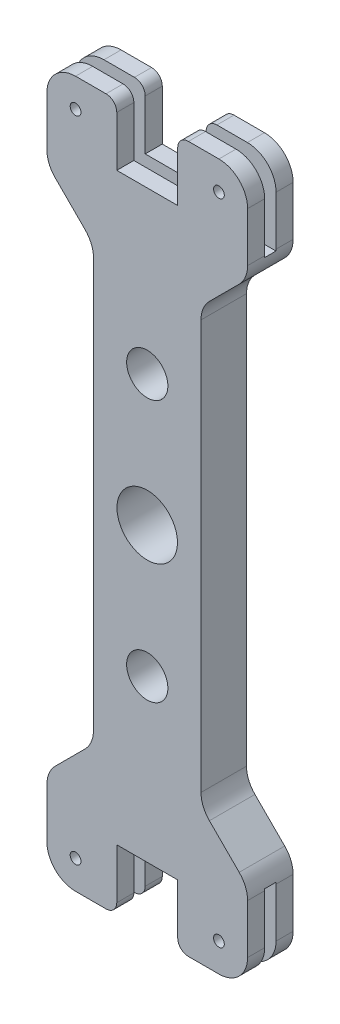
from build123d import *

# Parameters (mm, degrees)
SKETCH1_R                = 8.4375
SKETCH1_R_2              = 1.5
BOSS_EXTRUDE1_DEPTH      = 6.35
FILLET1_R                = 8
SKETCH3_W                = 56
SKETCH3_H                = 3.175
CUT_EXTRUDE1_DEPTH       = 22.22
F_7_16_CLEARANCE_HOLE4_D = 11.50874


with BuildPart() as part:
    # Sketch1 → Boss-Extrude1 (new, symmetric)
    with BuildSketch(Plane.XY):
        with BuildLine():
            Line((-28, 73.397835534), (-28, 90.475))
            ThreePointArc((-28, 90.475), (-25.656854249, 96.131854249), (-20, 98.475))
            Line((-20, 98.475), (-11.5, 98.475))
            ThreePointArc((-11.5, 98.475), (-9.378679656, 97.596320344), (-8.5, 95.475))
            Line((-8.5, 95.475), (-8.5, 81.475))
            Line((-8.5, 81.475), (8.5, 81.475))
            Line((8.5, 81.475), (8.5, 95.475))
            ThreePointArc((8.5, 95.475), (9.378679656, 97.596320344), (11.5, 98.475))
            Line((11.5, 98.475), (20, 98.475))
            ThreePointArc((20, 98.475), (25.656854249, 96.131854249), (28, 90.475))
            Line((28, 90.475), (28, 73.397835534))
            Line((28, 73.397835534), (15, 60.397835534))
            Line((15, 60.397835534), (15, -60.397835534))
            Line((15, -60.397835534), (28, -73.397835534))
            Line((28, -73.397835534), (28, -90.475))
            ThreePointArc((28, -90.475), (25.656854249, -96.131854249), (20, -98.475))
            Line((20, -98.475), (11.5, -98.475))
            ThreePointArc((11.5, -98.475), (9.378679656, -97.596320344), (8.5, -95.475))
            Line((8.5, -95.475), (8.5, -81.475))
            Line((8.5, -81.475), (-8.5, -81.475))
            Line((-8.5, -81.475), (-8.5, -95.475))
            ThreePointArc((-8.5, -95.475), (-9.378679656, -97.596320344), (-11.5, -98.475))
            Line((-11.5, -98.475), (-20, -98.475))
            ThreePointArc((-20, -98.475), (-25.656854249, -96.131854249), (-28, -90.475))
            Line((-28, -90.475), (-28, -73.397835534))
            Line((-28, -73.397835534), (-15, -60.397835534))
            Line((-15, -60.397835534), (-15, 60.397835534))
            Line((-15, 60.397835534), (-28, 73.397835534))
        make_face()
        Circle(SKETCH1_R, mode=Mode.SUBTRACT)
        with Locations((-20, 90.475)):
            Circle(SKETCH1_R_2, mode=Mode.SUBTRACT)
        with Locations((20, 90.475)):
            Circle(SKETCH1_R_2, mode=Mode.SUBTRACT)
        with Locations((20, -90.475)):
            Circle(SKETCH1_R_2, mode=Mode.SUBTRACT)
        with Locations((-20, -90.475)):
            Circle(SKETCH1_R_2, mode=Mode.SUBTRACT)
    extrude(amount=BOSS_EXTRUDE1_DEPTH, both=True)

    # Fillet1
    fillet1_edges = [part.edges().sort_by_distance(p)[0] for p in [
        (-28, 73.397835534, 0),
        (-15, 60.397835534, 0),
        (-28, -73.397835534, 0),
        (-15, -60.397835534, 0),
        (15, -60.397835534, 0),
        (28, -73.397835534, 0),
        (28, 73.397835534, 0),
        (15, 60.397835534, 0),
    ]]
    fillet(fillet1_edges, radius=FILLET1_R)

    # Sketch3 → Cut-Extrude1 (cut)
    with BuildSketch(Plane(origin=(0, 98.475, 0), x_dir=(1, 0, 0), z_dir=(0, 1, 0))):
        Rectangle(SKETCH3_W, SKETCH3_H)
    cut_extrude1 = extrude(amount=-CUT_EXTRUDE1_DEPTH, mode=Mode.SUBTRACT)

    # Mirror1: Cut-Extrude1 across plane
    add(cut_extrude1.mirror(Plane.ZX), mode=Mode.SUBTRACT)

    # 7/16 Clearance Hole4 (through all)
    with Locations(Plane.XY.offset(6.35)):
        with Locations((0, 36.5125), (0, -36.5125)):
            Hole(F_7_16_CLEARANCE_HOLE4_D / 2)


solid = part.part
